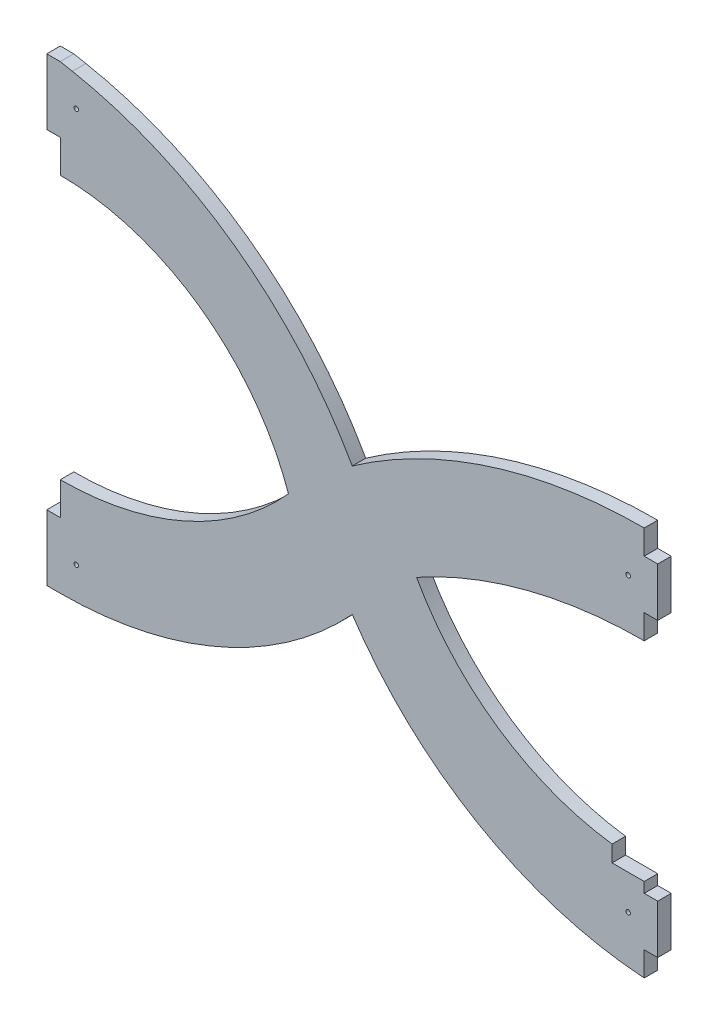
from build123d import *

# Parameters (mm, degrees)
SKETCH1_W           = 241.3
SKETCH1_H           = 198.12
BOSS_EXTRUDE1_DEPTH = 5.334
SKETCH2_W           = 5.334
SKETCH2_H           = 9.652
SKETCH2_H_2         = 96.012
SKETCH2_H_3         = 53.848
CUT_EXTRUDE1_DEPTH  = 179.277190048
SKETCH3_W           = 5.334
SKETCH3_H           = 16.256
SKETCH3_H_2         = 130.048
CUT_EXTRUDE2_DEPTH  = 179.277190048
CUT_EXTRUDE5_DEPTH  = 179.277190048
CUT_EXTRUDE6_DEPTH  = 179.277190048
CUT_EXTRUDE7_DEPTH  = 179.277190048
SKETCH8_R           = 0.889
CUT_EXTRUDE8_DEPTH  = 179.277190048
SKETCH9_R           = 0.889
CUT_EXTRUDE9_DEPTH  = 179.277190048
SKETCH10_W          = 12.7
SKETCH10_H          = 21.152854399
CUT_EXTRUDE10_DEPTH = 179.277190048


with BuildPart() as part:
    # Sketch1 → Boss-Extrude1 (new body)
    with BuildSketch(Plane.XY):
        with Locations((-21.329797884, -8.624919689)):
            Rectangle(SKETCH1_W, SKETCH1_H)
    extrude(amount=BOSS_EXTRUDE1_DEPTH)

    # Sketch2 → Cut-Extrude1 (cut, through all)
    with BuildSketch(Plane.XY.offset(5.334)):
        with Locations((96.653202116, -102.858919689)):
            Rectangle(SKETCH2_W, SKETCH2_H)
        with Locations((96.653202116, -30.722919689)):
            Rectangle(SKETCH2_W, SKETCH2_H_2)
        with Locations((96.653202116, 63.511080311)):
            Rectangle(SKETCH2_W, SKETCH2_H_3)
    extrude(amount=-CUT_EXTRUDE1_DEPTH, mode=Mode.SUBTRACT)

    # Sketch3 → Cut-Extrude2 (cut, through all)
    with BuildSketch(Plane.XY.offset(5.334)):
        with Locations((-139.312797884, -99.556919689)):
            Rectangle(SKETCH3_W, SKETCH3_H)
        with Locations((-139.312797884, -0.496919689)):
            Rectangle(SKETCH3_W, SKETCH3_H_2)
    extrude(amount=-CUT_EXTRUDE2_DEPTH, mode=Mode.SUBTRACT)

    # Sketch5 → Cut-Extrude5 (cut, through all)
    with BuildSketch(Plane.XY.offset(5.334)):
        Polygon((-136.645797884, -91.428919689), (93.986202116, -107.684919689), (93.986202116, -162.860416997), (-136.645797884, -146.604416997), align=None)
    extrude(amount=-CUT_EXTRUDE5_DEPTH, mode=Mode.SUBTRACT)

    # Sketch6 → Cut-Extrude6 (cut, through all)
    with BuildSketch(Plane.XY.offset(5.334)):
        Polygon((-136.645797884, 90.435080311), (93.986202116, 46.239080311), (93.986202116, 90.435080311), (-136.645797884, 134.631080311), align=None)
    extrude(amount=-CUT_EXTRUDE6_DEPTH, mode=Mode.SUBTRACT)

    # Sketch7 → Cut-Extrude7 (cut, through all)
    with BuildSketch(Plane.XY.offset(5.334)):
        with BuildLine():
            Line((-131.85688859, 89.517381834), (93.986202116, 46.239080311))
            ThreePointArc((93.986202116, 46.239080311), (33.516562096, 36.909943164), (-21.329797884, 9.790080311))
            ThreePointArc((-21.329797884, 9.790080311), (-67.77177066, 61.883202454), (-131.85688859, 89.517381834))
        make_face()
        with BuildLine():
            Line((-136.645797884, -91.428919689), (93.309245371, -107.637204677))
            ThreePointArc((93.309245371, -107.637204677), (28.257929174, -87.626903784), (-21.329797884, -41.009919689))
            ThreePointArc((-21.329797884, -41.009919689), (-73.717554191, -78.2732768), (-136.645797884, -91.428919689))
        make_face()
        with BuildLine():
            ThreePointArc((93.986202116, 7.631080311), (47.550679246, 1.726898301), (4.070202116, -15.609919689))
            ThreePointArc((4.070202116, -15.609919689), (41.092439587, -54.093369858), (92.347831876, -69.076919689))
            ThreePointArc((92.347831876, -69.076919689), (131.631647498, -31.544467715), (93.986202116, 7.631080311))
        make_face()
        with BuildLine():
            ThreePointArc((-136.645797884, 51.573080311), (-81.408536453, 33.982932584), (-46.514432981, -12.3092902))
            ThreePointArc((-46.514432981, -12.3092902), (-87.289086913, -42.04513502), (-136.645797884, -52.566919689))
            ThreePointArc((-136.645797884, -52.566919689), (-188.715797884, -0.496919689), (-136.645797884, 51.573080311))
        make_face()
    extrude(amount=-CUT_EXTRUDE7_DEPTH, mode=Mode.SUBTRACT)

    # Sketch8 → Cut-Extrude8 (cut, through all)
    with BuildSketch(Plane.XY.offset(5.334)):
        with Locations((-130.295797884, 77.481080311)):
            Circle(SKETCH8_R)
        with Locations((-130.295797884, -78.474919689)):
            Circle(SKETCH8_R)
    extrude(amount=-CUT_EXTRUDE8_DEPTH, mode=Mode.SUBTRACT)

    # Sketch9 → Cut-Extrude9 (cut, through all)
    with BuildSketch(Plane.XY.offset(5.334)):
        with Locations((87.636202116, 26.935080311)):
            Circle(SKETCH9_R)
        with Locations((87.636202116, -88.380919689)):
            Circle(SKETCH9_R)
    extrude(amount=-CUT_EXTRUDE9_DEPTH, mode=Mode.SUBTRACT)

    # Sketch10 → Cut-Extrude10 (cut, through all)
    with BuildSketch(Plane.XY.offset(5.334)):
        with Locations((87.636202116, -64.088492489)):
            Rectangle(SKETCH10_W, SKETCH10_H)
    extrude(amount=-CUT_EXTRUDE10_DEPTH, mode=Mode.SUBTRACT)


solid = part.part
